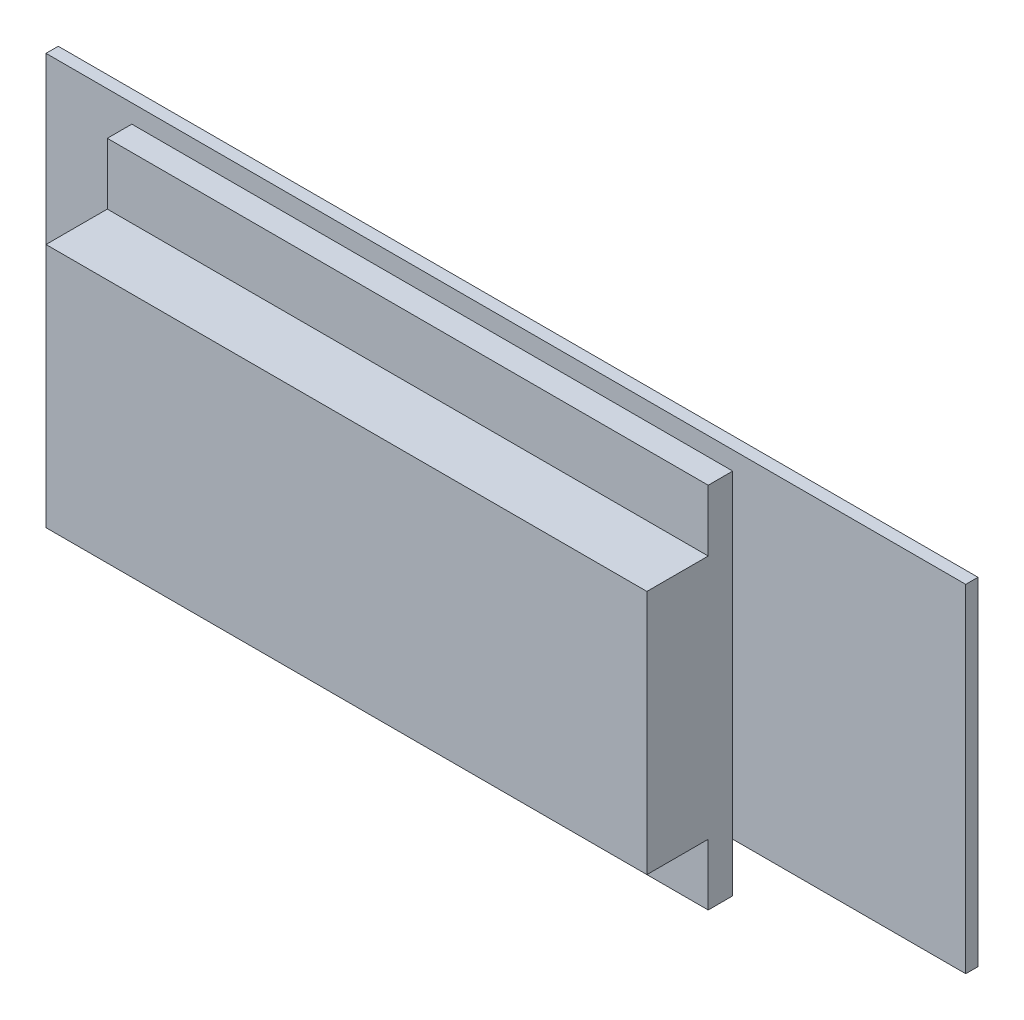
from build123d import *

# Parameters (mm, degrees)
SCHIZZO1_W                   = 150
SCHIZZO1_H                   = 55
ESTRUSIONE_ESTRUSIONE1_DEPTH = 2
SCHIZZO2_W                   = 98
SCHIZZO2_H                   = 60
ESTRUSIONE_ESTRUSIONE2_DEPTH = 4
SCHIZZO3_W                   = 98
SCHIZZO3_H                   = 40
ESTRUSIONE_ESTRUSIONE3_DEPTH = 10


with BuildPart() as part:
    # Schizzo1 → Estrusione-Estrusione1 (new body)
    with BuildSketch(Plane.XY):
        Rectangle(SCHIZZO1_W, SCHIZZO1_H)
    extrude(amount=ESTRUSIONE_ESTRUSIONE1_DEPTH)

    # Schizzo2 → Estrusione-Estrusione2 (add)
    with BuildSketch(Plane.XY.offset(2)):
        with Locations((-12, -5.5)):
            Rectangle(SCHIZZO2_W, SCHIZZO2_H)
    extrude(amount=ESTRUSIONE_ESTRUSIONE2_DEPTH)

    # Schizzo3 → Estrusione-Estrusione3 (add)
    with BuildSketch(Plane.XY.offset(6)):
        with Locations((-12, -5.5)):
            Rectangle(SCHIZZO3_W, SCHIZZO3_H)
    extrude(amount=ESTRUSIONE_ESTRUSIONE3_DEPTH)


solid = part.part
